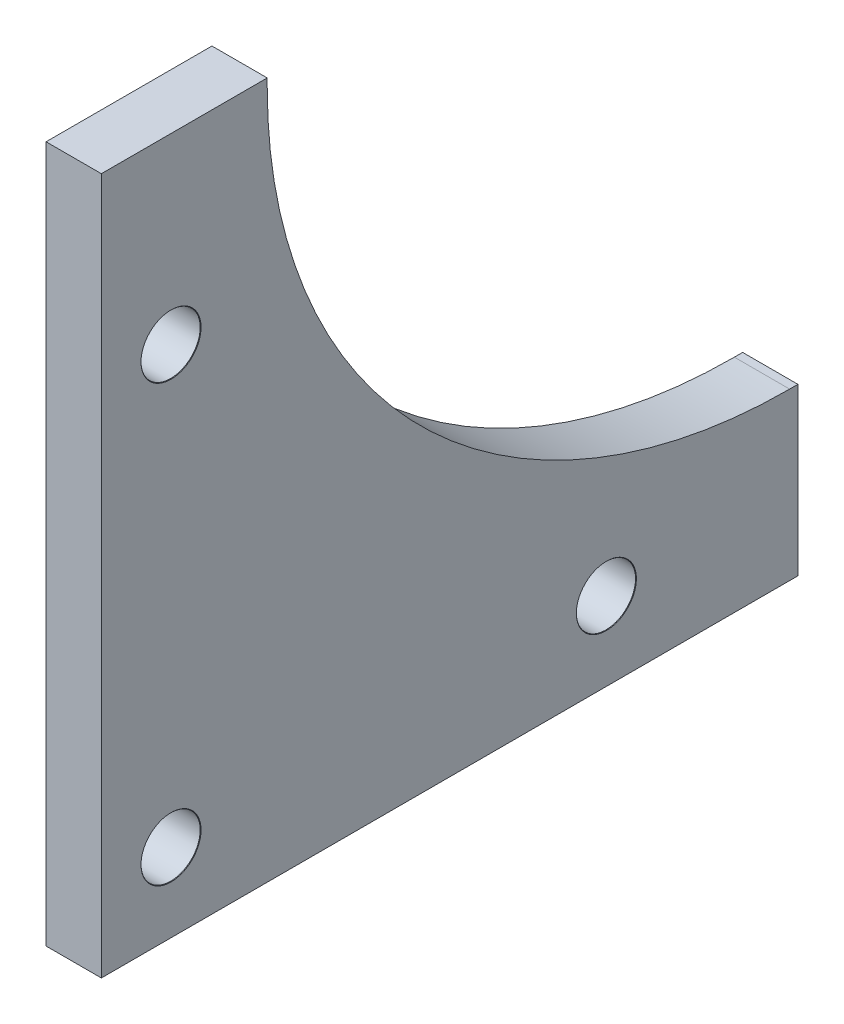
from build123d import *

# Parameters (mm, degrees)
BOSS_EXTRUDE1_DEPTH            = 3.175
M3_CLEARANCE_HOLE1_D           = 3.4
M3_CLEARANCE_HOLE1_CSINK_D     = 3.45
M3_CLEARANCE_HOLE1_CSINK_ANGLE = 90
FILLET1_R                      = 30


with BuildPart() as part:
    # Sketch1 → Boss-Extrude1 (new body)
    with BuildSketch(Plane(origin=(0, 0, 0), x_dir=(0, 0, -1), z_dir=(1, 0, 0))):
        Polygon((0, 0), (0, 40), (9.525, 40), (9.525, 9.525), (40, 9.525), (40, 0), align=None)
    extrude(amount=BOSS_EXTRUDE1_DEPTH)

    # M3 Clearance Hole1 (through all)
    with Locations(Plane(origin=(3.175, 0, 0), x_dir=(0, 0, -1), z_dir=(1, 0, 0))):
        with Locations((29, 4.5), (4, 29.5), (4, 4.5)):
            CounterSinkHole(M3_CLEARANCE_HOLE1_D / 2, M3_CLEARANCE_HOLE1_CSINK_D / 2, counter_sink_angle=M3_CLEARANCE_HOLE1_CSINK_ANGLE)

    # Fillet1
    fillet1_edges = [part.edges().sort_by_distance(p)[0] for p in [
        (1.5875, 9.525, -9.525),
    ]]
    fillet(fillet1_edges, radius=FILLET1_R)


solid = part.part
